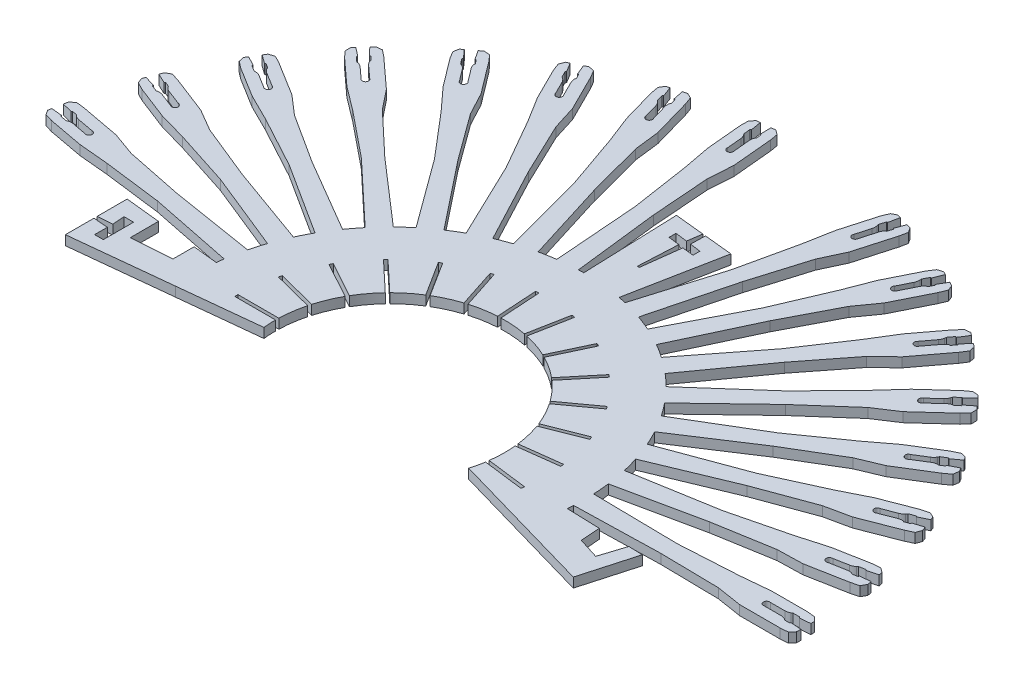
from build123d import *

# Parameters (mm, degrees)
SKETCH2_R               = 5.970700102
BOSS_EXTRUDE1_DEPTH     = 0.5
BOSS_EXTRUDE2_DEPTH     = 0.5
BOSS_EXTRUDE3_DEPTH     = 0.5
CIRPATTERN1_COUNT       = 18
CIRPATTERN1_ANGLE       = 180
CUT_EXTRUDE4_DEPTH      = 103.528378943
CUT_EXTRUDE4_DEPTH_BACK = 0.5
CUT_EXTRUDE6_DEPTH      = 103.528378943
CUT_EXTRUDE6_DEPTH_BACK = 0.5
CUT_EXTRUDE13_DEPTH     = 10
SKETCH13_R              = 2.29112386
SKETCH13_W              = 5.561420579
SKETCH13_H              = 0.165877453
CUT_EXTRUDE14_DEPTH     = 103.528378943


with BuildPart() as part:
    # Sketch2 → Boss-Extrude1 (new body)
    with BuildSketch(Plane(origin=(0, 0, 0), x_dir=(1, 0, 0), z_dir=(0, 1, 0))):
        with BuildLine():
            Line((41.736564116, 50.95828476), (36.555246465, 51.501399508))
            Line((36.555246465, 51.501399508), (36.555246465, 48.286890075))
            Line((36.555246465, 48.286890075), (41.732722408, 48.833722572))
            ThreePointArc((41.732722408, 48.833722572), (41.733244647, 48.828783324), (41.733769301, 48.82384433))
            ThreePointArc((41.733769301, 48.82384433), (50.963390645, 39.773597615), (61.612393233, 47.101054176))
            Line((61.612393233, 47.101054176), (66.500703475, 45.70083261))
            Line((66.500703475, 45.70083261), (67.011967053, 48.840095645))
            Line((67.011967053, 48.840095645), (61.960868148, 49.001189769))
            ThreePointArc((61.960868148, 49.001189769), (59.963353335, 56.003029367), (53.794021492, 59.87022057))
            Line((53.794021492, 59.87022057), (54.740102943, 64.742398272))
            Line((54.740102943, 64.742398272), (51.585987879, 65.064191003))
            Line((51.585987879, 65.064191003), (51.764987526, 60.059419928))
            ThreePointArc((51.764987526, 60.059419928), (45.016500937, 57.426340658), (41.737479755, 50.966991019))
            ThreePointArc((41.737479755, 50.966991019), (41.737020998, 50.962637988), (41.736564116, 50.95828476))
        make_face()
        with Locations((51.841, 49.9)):
            Circle(SKETCH2_R, mode=Mode.SUBTRACT)
    extrude(amount=BOSS_EXTRUDE1_DEPTH)

    # Sketch3 → Boss-Extrude2 (add)
    with BuildSketch(Plane(origin=(0, 0, 0), x_dir=(1, 0, 0), z_dir=(0, 1, 0))):
        with BuildLine():
            Line((34.211762714, 50.432343653), (32.909296349, 50.640369452))
            Line((32.909296349, 50.640369452), (30.809881501, 50.640369452))
            Line((30.809881501, 50.640369452), (30.395106085, 50.609778247))
            Line((30.395106085, 50.609778247), (30.19673075, 50.381755064))
            Line((30.19673075, 50.381755064), (30.19673075, 50.155341291))
            Line((30.19673075, 50.155341291), (30.751642814, 50.115954685))
            Line((30.751642814, 50.115954685), (30.77934318, 50.166089344))
            Line((30.77934318, 50.166089344), (31.05223499, 50.166089344))
            Line((31.05223499, 50.166089344), (31.099611042, 50.115954685))
            ThreePointArc((31.099611042, 50.115954685), (31.212835939, 50.072760512), (31.33312703, 50.058074898))
            Line((31.33312703, 50.058074898), (32.194162187, 50.058074898))
            ThreePointArc((32.194162187, 50.058074898), (32.402734239, 49.901106961), (32.196297658, 49.741340968))
            Line((32.196297658, 49.741340968), (31.442399472, 49.741340968))
            ThreePointArc((31.442399472, 49.741340968), (31.313894497, 49.724545346), (31.194022805, 49.675286853))
            Line((31.194022805, 49.675286853), (31.119929258, 49.63287809))
            Line((31.119929258, 49.63287809), (30.778751544, 49.63287809))
            Line((30.778751544, 49.63287809), (30.751642814, 49.68504936))
            Line((30.751642814, 49.68504936), (30.19673075, 49.640524895))
            Line((30.19673075, 49.640524895), (30.19673075, 49.451229248))
            Line((30.19673075, 49.451229248), (30.395106085, 49.241340968))
            Line((30.395106085, 49.241340968), (30.819114292, 49.196565709))
            Line((30.819114292, 49.196565709), (32.668810537, 49.196565709))
            Line((32.668810537, 49.196565709), (34.213032078, 49.341035012))
            Line((34.213032078, 49.341035012), (37.255402915, 49.518558921))
            Line((37.255402915, 49.518558921), (41.728172663, 49.451229248))
            Line((41.728172663, 49.451229248), (41.728172663, 50.491060026))
            Line((41.728172663, 50.491060026), (37.255402915, 50.381755064))
            Line((37.255402915, 50.381755064), (34.211762714, 50.432343653))
        make_face()
    boss_extrude2 = extrude(amount=BOSS_EXTRUDE2_DEPTH)

    # CirPattern1: Boss-Extrude2 ×18 about axis
    cirpattern1_axis = Axis((51.841, 0.5, -49.9), (0, -1, 0))
    for i in range(1, CIRPATTERN1_COUNT):
        add(boss_extrude2.rotate(cirpattern1_axis, i * CIRPATTERN1_ANGLE / (CIRPATTERN1_COUNT - 1)))

    # Sketch8 → Cut-Extrude4 (cut, two sides: drawn at the far end of the back side and taken through both)
    with BuildSketch(Plane(origin=(0, 0, 0), x_dir=(1, 0, 0), z_dir=(0, 1, 0)).offset(-CUT_EXTRUDE4_DEPTH_BACK)):
        Polygon((36.555246465, 48.286890075), (27.995570216, 47.169676763), (27.995570216, 52.890741223), (36.555246465, 51.501399508), (36.555246465, 48.753981284), align=None)
        Polygon((51.655565612, 72.526598057), (51.585987879, 65.064191003), (54.740102943, 64.742398272), (56.406958129, 72.526598057), align=None)
        Polygon((47.95502979, 51.501399508), (46.998338953, 48.798), (52.839188276, 46.161429513), (54.740102943, 51.719098387), align=None)
    extrude(amount=CUT_EXTRUDE4_DEPTH + CUT_EXTRUDE4_DEPTH_BACK, mode=Mode.SUBTRACT)


with BuildPart() as body_2:
    # Sketch5 → Boss-Extrude3 (new body)
    with BuildSketch(Plane(origin=(0, 0, 0), x_dir=(1, 0, 0), z_dir=(0, 1, 0))):
        Polygon((51.841, 49.9), (51.841, 47.98601508), (47.518666367, 49.9), align=None)
    extrude(amount=BOSS_EXTRUDE3_DEPTH)


with BuildPart() as cut_extrude6_tool:
    # Sketch9 → Cut-Extrude6 (new, two sides: drawn at the far end of the back side and taken through both)
    with BuildSketch(Plane(origin=(0, 0, 0), x_dir=(1, 0, 0), z_dir=(0, 1, 0)).offset(-CUT_EXTRUDE6_DEPTH_BACK)):
        Polygon((36.555246465, 48.286890075), (47.009139853, 49.390092422), (47.587964148, 50.49093808), (51.841, 49.9), (66.500703475, 45.70083261), (51.841, 34.857894493), align=None)
    extrude(amount=CUT_EXTRUDE6_DEPTH + CUT_EXTRUDE6_DEPTH_BACK)


with BuildPart() as part_1:
    add(part.part)

    # Cut-Extrude6: cut by cut_extrude6_tool
    add(cut_extrude6_tool.part, mode=Mode.SUBTRACT)

    # Sketch12 → Cut-Extrude13 (cut)
    with BuildSketch(Plane(origin=(0, 0, 0), x_dir=(1, 0, 0), z_dir=(0, 1, 0))):
        Polygon((36.555246465, 51.501399508), (38.377437868, 51.501399508), (38.377437868, 49.846380566), (40.450129226, 49.985069668), (40.450129226, 51.16915959), (37.317153392, 51.720562063), align=None)
        Polygon((66.036768105, 49.006664529), (65.095153252, 45.671159721), (66.958125451, 45.145241638), (67.462296373, 48.891444034), align=None)
        Polygon((53.295474798, 66.106694164), (53.008344299, 64.164198086), (52.385771098, 64.24300482), (52.385771098, 63.878888302), (52.968388494, 63.805139265), (52.865117029, 61.750356694), (52.968388494, 61.744315108), (53.219966865, 63.759577119), (53.814395603, 63.698049757), (53.814395603, 64.054600552), (53.253005141, 64.131855132), align=None)
        Polygon((65.273932949, 48.895526569), (64.858820111, 47.588272269), (63.761063297, 47.936860104), (63.677982038, 49.064928372), (65.504842158, 49.006664529), align=None)
        Polygon((35.431152546, 49.858633501), (37.312510157, 49.997193872), (37.266298078, 50.624656446), (37.766087028, 50.624656446), (37.766087028, 49.051172586), (37.312510157, 49.051172586), (37.312510157, 49.715786798), align=None)
    extrude(amount=CUT_EXTRUDE13_DEPTH, mode=Mode.SUBTRACT)

    # Sketch13 → Cut-Extrude14 (cut, through all)
    with BuildSketch(Plane(origin=(0, 0, 0), x_dir=(1, 0, 0), z_dir=(0, 1, 0))):
        with Locations((51.841102424, 49.89933139)):
            Circle(SKETCH13_R)
        Polygon((49.391914384, 50.541352609), (44.00521606, 51.924421665), (44.046468105, 52.085087773), (49.433166429, 50.702018717), align=None)
        with Locations((46.528485657, 49.995032761)):
            Rectangle(SKETCH13_W, SKETCH13_H)
        Polygon((49.628524315, 51.130270629), (44.755014311, 53.809505426), (44.834926384, 53.954864946), (49.708436387, 51.275630149), align=None)
        Polygon((50.004158665, 51.64184421), (45.95005754, 55.448898572), (46.06360847, 55.569818031), (50.117709596, 51.762763669), align=None)
        Polygon((50.495214948, 52.043929301), (47.515256784, 56.739592001), (47.655311749, 56.828473585), (50.635269914, 52.132810885), align=None)
        Polygon((51.07083829, 52.311261419), (49.352264819, 57.6004867), (49.510023651, 57.651745652), (51.228597123, 52.362520371), align=None)
        Polygon((51.694860161, 52.427043102), (51.345655674, 57.977489487), (51.511205805, 57.987905019), (51.860410293, 52.437458633), align=None)
        Polygon((52.328070971, 52.383999362), (53.37017727, 57.846911892), (53.533116577, 57.815829557), (52.491010278, 52.352917027), align=None)
        Polygon((52.930683756, 52.184834796), (55.29862147, 57.216958585), (55.448711877, 57.146331401), (53.080774163, 52.114207611), align=None)
        Polygon((53.464834139, 51.842063645), (57.009817033, 56.127211849), (57.137627807, 56.021477581), (53.592644913, 51.736329377), align=None)
        Polygon((53.896959487, 51.377223481), (58.396243248, 54.646144479), (58.493743568, 54.511946801), (53.994459807, 51.243025803), align=None)
        Polygon((54.199907774, 50.819521923), (59.370785856, 52.866817385), (59.431849419, 52.71258843), (54.260971337, 50.665292967), align=None)
        Polygon((54.354643646, 50.204001408), (59.872210762, 50.901032233), (59.89300072, 50.736462773), (54.375433604, 50.039431949), align=None)
        Polygon((54.351444479, 49.569337357), (59.869011595, 48.872306532), (59.848221638, 48.707737073), (54.330654521, 49.404767897), align=None)
        Polygon((54.190511288, 48.955408043), (59.36138937, 46.908112581), (59.300325807, 46.753883625), (54.129447725, 48.801179088), align=None)
        Polygon((53.881956098, 48.400788906), (58.381239859, 45.131867908), (58.283739538, 44.997670229), (53.784455777, 48.266591227), align=None)
        Polygon((53.445166565, 47.940328703), (56.990149459, 43.655180499), (56.862338685, 43.549446231), (53.317355791, 47.834594436), align=None)
        Polygon((52.907587784, 47.602959845), (55.275525498, 42.570836055), (55.125435091, 42.500208871), (52.757497377, 47.53233266), align=None)
        Polygon((52.302997804, 47.409880456), (53.345104103, 41.946967926), (53.182164796, 41.91588559), (52.140058497, 47.378798121), align=None)
        Polygon((51.66938524, 47.373222424), (51.320180752, 41.822776039), (51.154630621, 41.833191571), (51.503835108, 47.383637956), align=None)
        Polygon((51.046562297, 47.49528911), (49.327988826, 42.206063829), (49.170229993, 42.257322781), (50.888803465, 47.546548062), align=None)
        Polygon((50.473663233, 47.768410613), (47.493705069, 43.072747913), (47.353650103, 43.161629497), (50.333608267, 47.857292197), align=None)
        Polygon((49.986685402, 48.175425706), (45.932584276, 44.368371344), (45.819033346, 44.489290803), (49.873134472, 48.296345165), align=None)
        Polygon((49.616227413, 48.690760133), (44.742717409, 46.011525336), (44.662805337, 46.156884856), (49.53631534, 48.836119653), align=None)
        Polygon((49.385566503, 49.282033537), (43.998868179, 47.898964481), (43.957616134, 48.059630588), (49.344314458, 49.442699644), align=None)
    extrude(amount=CUT_EXTRUDE14_DEPTH, mode=Mode.SUBTRACT)


with BuildPart() as body_2_1:
    add(body_2.part)

    # Cut-Extrude6: cut by cut_extrude6_tool
    add(cut_extrude6_tool.part, mode=Mode.SUBTRACT)


solid = part_1.part
